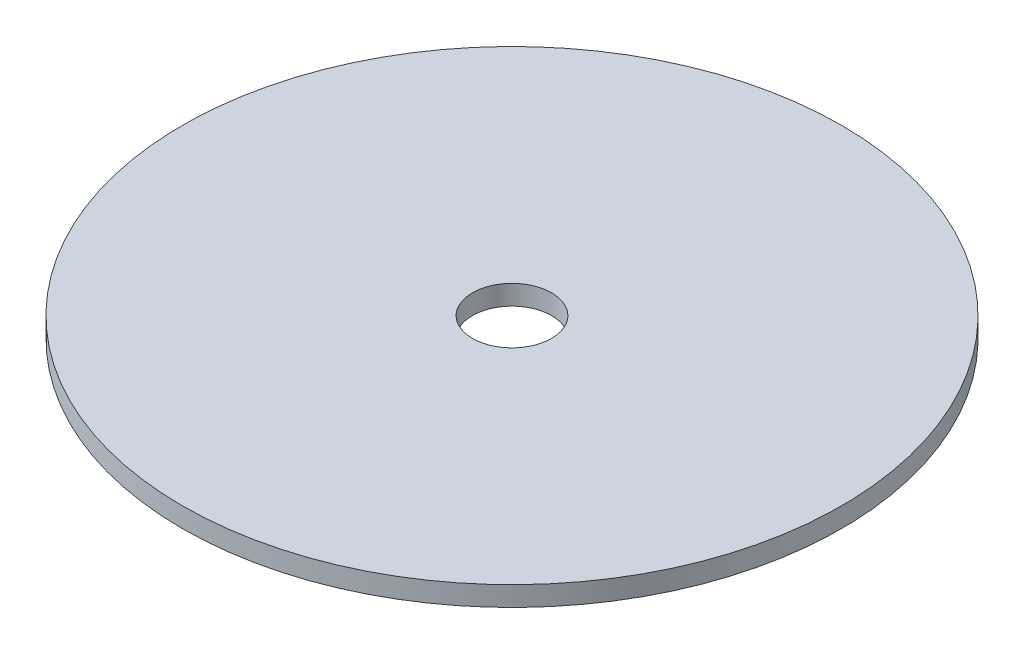
from build123d import *

# Parameters (mm, degrees)
SKETCH1_R          = 25
BASE_FLANGE1_DEPTH = 1.5
HOLE1_START        = -1.5
HOLE1_OUTLINE_R    = 3
HOLE1_DEPTH        = 1.5


# Read off the part's stored shape, not the designer's step: Hole1
# Sheet-metal steps are written as plain solids
with BuildPart() as part:
    # Sketch1 → Base-Flange1 (new body)
    with BuildSketch(Plane(origin=(0, 0, 0), x_dir=(1, 0, 0), z_dir=(0, 1, 0))):
        with Locations(Location((0, 0, 0), (0, 0, 270))):
            Circle(SKETCH1_R)
    extrude(amount=-BASE_FLANGE1_DEPTH)

    # Hole1 outline → Hole1 (cut)
    with BuildSketch(Plane(origin=(0, 0, 0), x_dir=(1, 0, 0), z_dir=(0, 1, 0)).offset(HOLE1_START)):
        Circle(HOLE1_OUTLINE_R)
    extrude(amount=HOLE1_DEPTH, mode=Mode.SUBTRACT)


solid = part.part
